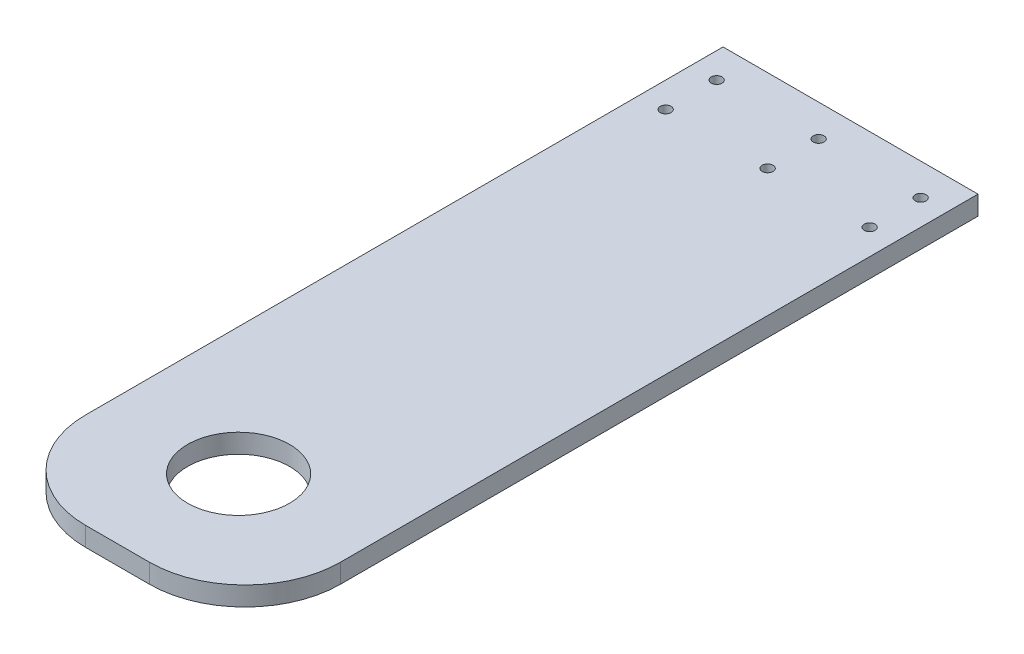
from build123d import *

# Parameters (mm, degrees)
SKETCH1_W                                           = 80
SKETCH1_H                                           = 230
BOSS_EXTRUDE1_DEPTH                                 = 6
F_32_0_32_DIAMETER_HOLE1_D                          = 32
FILLET1_R                                           = 30
CBORE_FOR_M3_HEX_SOCKET_HEAD_CAP_SCREW1_D           = 3.4
CBORE_FOR_M3_HEX_SOCKET_HEAD_CAP_SCREW1_CBORE_D     = 6.5
CBORE_FOR_M3_HEX_SOCKET_HEAD_CAP_SCREW1_CBORE_DEPTH = 3.4


with BuildPart() as part:
    # Sketch1 → Boss-Extrude1 (new body)
    with BuildSketch(Plane(origin=(0, 0, 0), x_dir=(1, 0, 0), z_dir=(0, 1, 0))):
        with Locations((40, -115)):
            Rectangle(SKETCH1_W, SKETCH1_H)
    extrude(amount=BOSS_EXTRUDE1_DEPTH)

    # Ø32.0 (32) Diameter Hole1 (through all)
    with Locations(Plane(origin=(0, 6, 0), x_dir=(1, 0, 0), z_dir=(0, 1, 0))):
        with Locations((40, -192)):
            Hole(F_32_0_32_DIAMETER_HOLE1_D / 2)

    # Fillet1
    fillet1_edges = [part.edges().sort_by_distance(p)[0] for p in [
        (0, 3, 230),
        (80, 3, 230),
    ]]
    fillet(fillet1_edges, radius=FILLET1_R)

    # CBORE for M3 Hex Socket Head Cap Screw1 (through all)
    with Locations(Plane.XZ):
        with Locations((8, 10), (40, 10), (72, 10), (40, 26), (72, 26), (8, 26)):
            CounterBoreHole(CBORE_FOR_M3_HEX_SOCKET_HEAD_CAP_SCREW1_D / 2, CBORE_FOR_M3_HEX_SOCKET_HEAD_CAP_SCREW1_CBORE_D / 2, CBORE_FOR_M3_HEX_SOCKET_HEAD_CAP_SCREW1_CBORE_DEPTH)


solid = part.part
